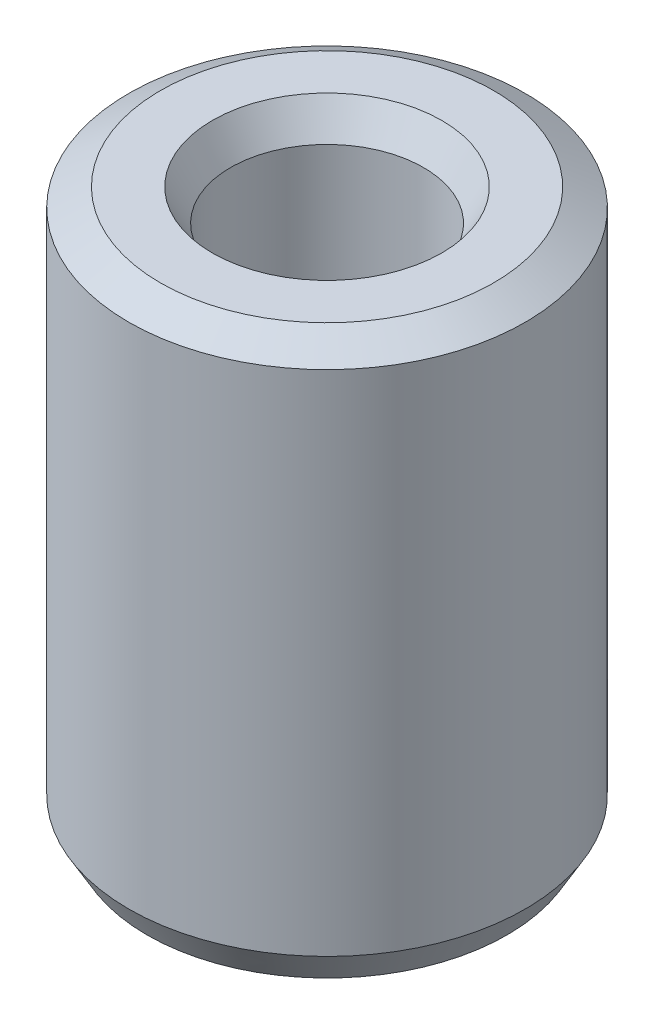
from build123d import *
from OCP.BRepFilletAPI import BRepFilletAPI_MakeChamfer

# Parameters (mm, degrees)
SKETCH1_R           = 37.5
BOSS_EXTRUDE1_DEPTH = 105.562151461
SKETCH2_R           = 18.259569953
CUT_EXTRUDE1_DEPTH  = 119.134955966
CHAMFER1_SIZE       = 3.45289735
CHAMFER1_SIZE2      = 5.980593644


with BuildPart() as part:
    # Sketch1 → Boss-Extrude1 (new body)
    with BuildSketch(Plane(origin=(0, 0, 0), x_dir=(1, 0, 0), z_dir=(0, 1, 0))):
        Circle(SKETCH1_R)
    extrude(amount=BOSS_EXTRUDE1_DEPTH)

    # Sketch2 → Cut-Extrude1 (cut, through all)
    with BuildSketch(Plane(origin=(0, 0, 0), x_dir=(1, 0, 0), z_dir=(0, 1, 0))):
        Circle(SKETCH2_R)
    extrude(amount=CUT_EXTRUDE1_DEPTH, mode=Mode.SUBTRACT)

    # Chamfer1: one chamfer whose edges measure the first distance from different faces: ONE call of the kernel's chamfer builder (chamfer() names one face for all edges)
    chamfer1_edges_1 = [part.edges().sort_by_distance(p)[0] for p in [
        (-18.259569953, 105.562151461, 0),
    ]]
    chamfer1_side_1 = [part.faces().sort_by_distance(p)[0] for p in [
        (-36.439339828, 105.562151461, 0),
    ]]
    chamfer1_edges_2 = [part.edges().sort_by_distance(p)[0] for p in [
        (-18.259569953, 0, 0),
    ]]
    chamfer1_side_2 = [part.faces().sort_by_distance(p)[0] for p in [
        (-18.259569953, 52.781075731, 0),
    ]]
    chamfer1_edges_3 = [part.edges().sort_by_distance(p)[0] for p in [
        (-37.5, 0, 0),
    ]]
    chamfer1_side_3 = [part.faces().sort_by_distance(p)[0] for p in [
        (-36.439339828, 0, 0),
    ]]
    chamfer1_edges_4 = [part.edges().sort_by_distance(p)[0] for p in [
        (-37.5, 105.562151461, 0),
    ]]
    chamfer1_side_4 = [part.faces().sort_by_distance(p)[0] for p in [
        (-37.5, 52.781075731, 0),
    ]]
    chamfer1 = BRepFilletAPI_MakeChamfer(part.part.solid().wrapped)
    for e in chamfer1_edges_1:
        chamfer1.Add(CHAMFER1_SIZE, CHAMFER1_SIZE2, e.wrapped, chamfer1_side_1[0].wrapped)  # the first distance lies on this face
    for e in chamfer1_edges_2:
        chamfer1.Add(CHAMFER1_SIZE, CHAMFER1_SIZE2, e.wrapped, chamfer1_side_2[0].wrapped)  # the first distance lies on this face
    for e in chamfer1_edges_3:
        chamfer1.Add(CHAMFER1_SIZE, CHAMFER1_SIZE2, e.wrapped, chamfer1_side_3[0].wrapped)  # the first distance lies on this face
    for e in chamfer1_edges_4:
        chamfer1.Add(CHAMFER1_SIZE, CHAMFER1_SIZE2, e.wrapped, chamfer1_side_4[0].wrapped)  # the first distance lies on this face
    add(Compound.cast(chamfer1.Shape()), mode=Mode.REPLACE)


solid = part.part
